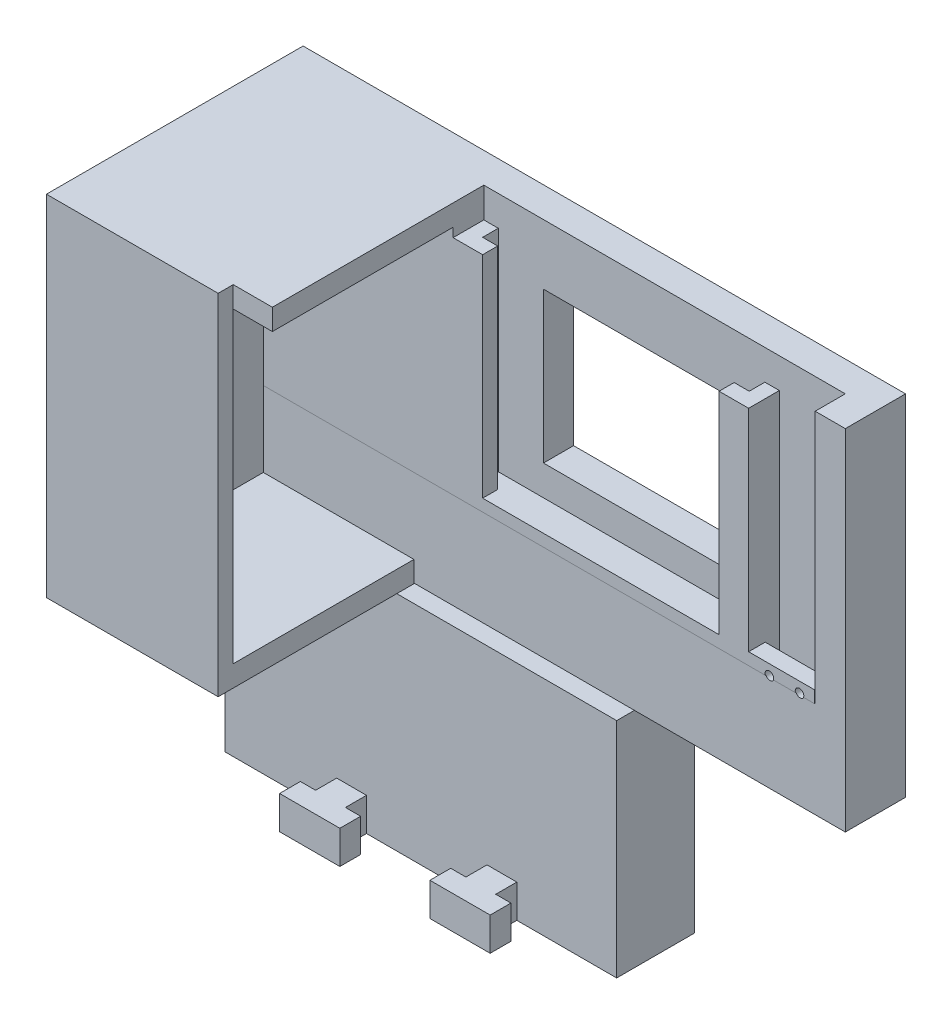
from build123d import *

# Parameters (mm, degrees)
SKETCH1_W            = 190
SKETCH1_H            = 80
BOSS_EXTRUDE1_DEPTH  = 10
BOSS_EXTRUDE2_DEPTH  = 70
SKETCH3_W            = 58.5
SKETCH3_H            = 50
CUT_EXTRUDE1_DEPTH   = 10
SKETCH5_W            = 190
SKETCH5_H            = 20.2
BOSS_EXTRUDE3_DEPTH  = 4
BOSS_EXTRUDE5_DEPTH  = 20
SKETCH7_W            = 200
SKETCH7_H            = 74
SKETCH7_W_2          = 0.268020534
SKETCH7_H_2          = 19.603817147
BOSS_EXTRUDE6_DEPTH  = 5.9
BOSS_EXTRUDE7_DEPTH  = 11
SKETCH21_W           = 21.9
SKETCH21_H           = 4.7
CUT_EXTRUDE7_DEPTH   = 5.5
SKETCH22_R           = 1.425
CUT_EXTRUDE8_DEPTH   = 5.5
SKETCH23_W           = 70
SKETCH23_H           = 80
BOSS_EXTRUDE8_DEPTH  = 10.2
SKETCH24_W           = 70
SKETCH24_H           = 74
CUT_EXTRUDE9_DEPTH   = 185.921091279
BOSS_EXTRUDE10_DEPTH = 60
SKETCH26_W           = 57
SKETCH26_H           = 116
BOSS_EXTRUDE11_DEPTH = 5


with BuildPart() as part:
    # Sketch1 → Boss-Extrude1 (new body)
    with BuildSketch(Plane.XY):
        Rectangle(SKETCH1_W, SKETCH1_H)
    extrude(amount=BOSS_EXTRUDE1_DEPTH)

    # Sketch2 → Boss-Extrude2 (add)
    with BuildSketch(Plane.XZ.offset(40)):
        Polygon((-25, 10), (-20.2, 10), (-20.2, 15.2), (-15.2, 15.2), (-15.2, 20.2), (-25, 20.2), align=None)
        Polygon((68.3, 10), (73.1, 10), (73.1, 20.2), (63.3, 20.2), (63.3, 15.2), (68.3, 15.2), align=None)
    extrude(amount=-BOSS_EXTRUDE2_DEPTH)

    # Sketch3 → Cut-Extrude1 (cut)
    with BuildSketch(Plane.XY.offset(10)):
        with Locations((24.05, -5)):
            Rectangle(SKETCH3_W, SKETCH3_H)
    extrude(amount=-CUT_EXTRUDE1_DEPTH, mode=Mode.SUBTRACT)

    # Sketch5 → Boss-Extrude3 (add)
    with BuildSketch(Plane(origin=(0, -40, 0), x_dir=(-1, 0, 0), z_dir=(0, -1, 0))):
        with Locations((0, -10.1)):
            Rectangle(SKETCH5_W, SKETCH5_H)
    extrude(amount=BOSS_EXTRUDE3_DEPTH)

    # Sketch6 → Boss-Extrude5 (add)
    with BuildSketch(Plane(origin=(0, 0, 0), x_dir=(-1, 0, 0), z_dir=(0, 0, -1))):
        Polygon((95, -150), (95, -44), (-95, -44), (-95, 40), (-105, 40), (-105, -150), align=None)
    extrude(amount=-BOSS_EXTRUDE5_DEPTH)

    # Sketch7 → Boss-Extrude6 (add)
    with BuildSketch(Plane.XY.offset(20)):
        with Locations((5, -113)):
            Rectangle(SKETCH7_W, SKETCH7_H)
        with Locations((70.627340548, -99.185279167)):
            Rectangle(SKETCH7_W_2, SKETCH7_H_2, mode=Mode.SUBTRACT)
    extrude(amount=BOSS_EXTRUDE6_DEPTH)

    # Sketch8 → Boss-Extrude7 (add)
    with BuildSketch(Plane.XZ.offset(150)):
        Polygon((-63, 32.9), (-57.95, 32.9), (-57.95, 25.9), (-48.05, 25.9), (-48.05, 32.9), (-43, 32.9), (-43, 39.8), (-63, 39.8), align=None)
        Polygon((-8.05, 32.9), (-8.05, 25.9), (1.85, 25.9), (1.85, 32.9), (6.9, 32.9), (6.9, 39.8), (-13.1, 39.8), (-13.1, 32.9), align=None)
    extrude(amount=-BOSS_EXTRUDE7_DEPTH)

    # Sketch21 → Cut-Extrude7 (cut)
    with BuildSketch(Plane(origin=(0, -40, 0), x_dir=(1, 0, 0), z_dir=(0, 1, 0))):
        with Locations((84.05, -12.35)):
            Rectangle(SKETCH21_W, SKETCH21_H)
    extrude(amount=-CUT_EXTRUDE7_DEPTH, mode=Mode.SUBTRACT)

    # Sketch22 → Cut-Extrude8 (cut)
    with BuildSketch(Plane.XY.offset(20.2)):
        with Locations((90, -43.5)):
            Circle(SKETCH22_R)
        with Locations((80, -43.5)):
            Circle(SKETCH22_R)
    extrude(amount=-CUT_EXTRUDE8_DEPTH, mode=Mode.SUBTRACT)

    # Sketch23 → Boss-Extrude8 (add)
    with BuildSketch(Plane.XY.offset(10)):
        with Locations((-60, 0)):
            Rectangle(SKETCH23_W, SKETCH23_H)
    extrude(amount=BOSS_EXTRUDE8_DEPTH)

    # Sketch24 → Cut-Extrude9 (cut, through all)
    with BuildSketch(Plane.XY.offset(25.9)):
        with Locations((70, -113)):
            Rectangle(SKETCH24_W, SKETCH24_H)
    extrude(amount=-CUT_EXTRUDE9_DEPTH, mode=Mode.SUBTRACT)

    # Sketch25 → Boss-Extrude10 (add)
    with BuildSketch(Plane.XY.offset(20.2)):
        Polygon((-25, 33), (-25, 40), (-95, 40), (-95, -76), (-38, -76), (-38, -69), (-88, -69), (-88, 33), align=None)
    extrude(amount=BOSS_EXTRUDE10_DEPTH)

    # Sketch26 → Boss-Extrude11 (add)
    with BuildSketch(Plane.XY.offset(80.2)):
        with Locations((-66.5, -18)):
            Rectangle(SKETCH26_W, SKETCH26_H)
    extrude(amount=BOSS_EXTRUDE11_DEPTH)


solid = part.part
